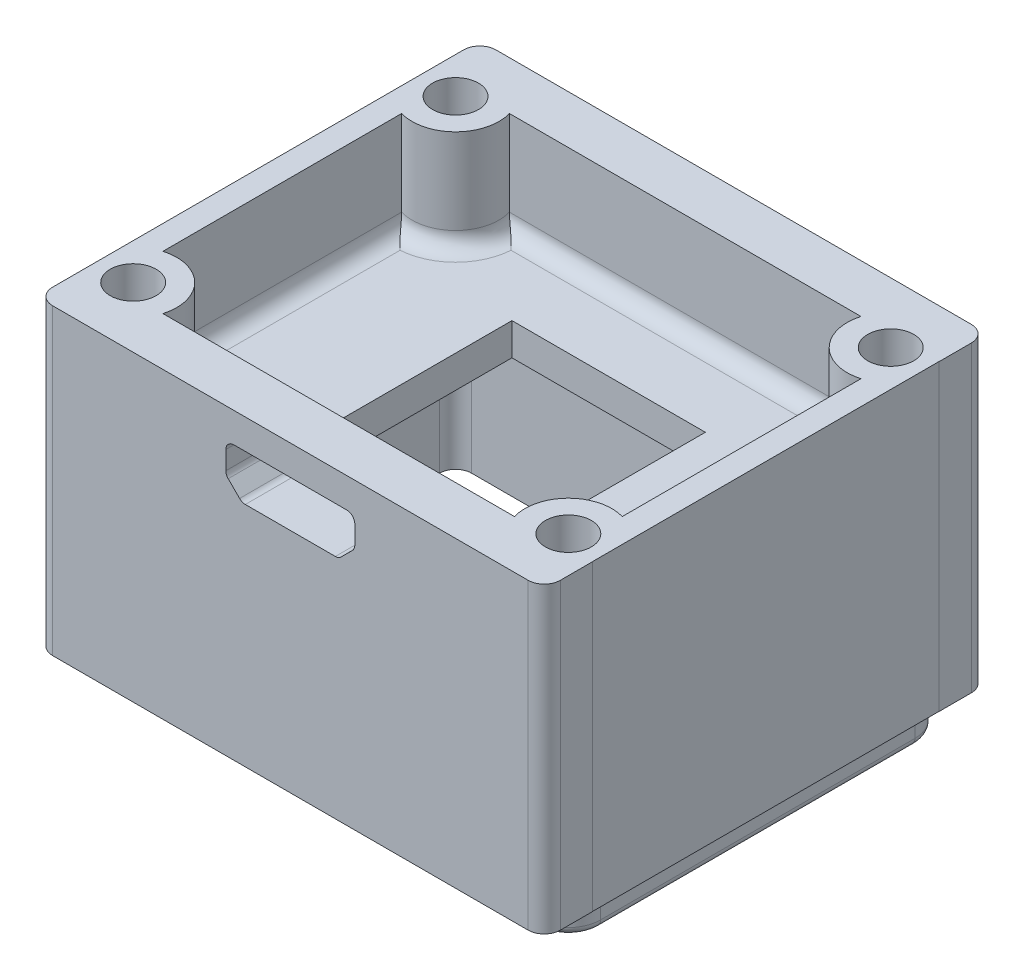
from build123d import *

# Parameters (mm, degrees)
SKETCH_1_W               = 31.500375693
SKETCH_1_H               = 27.5
EXTRUDE_1_DEPTH          = 18.8
SKETCH_2_W               = 0.007172267
SKETCH_2_H               = 21.5
CUT_EXTRUDE_1_DEPTH      = 18.8
SKETCH_3_W               = 30.5
SKETCH_3_H               = 23.5
EXTRUDE_2_DEPTH          = 1.7
SKETCH_4_W               = 28.5
SKETCH_4_H               = 21.5
CUT_EXTRUDE_2_DEPTH      = 12.2
SKETCH_5_W               = 15.8
SKETCH_5_H               = 15.8
EXTRUDE_3_DEPTH          = 0.8
CUT_EXTRUDE_3_DEPTH      = 6.3
SKETCH_7_W               = 14.2
SKETCH_7_H               = 14.2
CUT_EXTRUDE_4_DEPTH      = 0.8
SKETCH_8_W               = 12
SKETCH_8_H               = 12
CUT_EXTRUDE_5_DEPTH      = 26.276152686
CUT_EXTRUDE_6_REACH      = 39.211
HOLE_WIZARD_M2_5_1_D     = 2.85
HOLE_WIZARD_M2_5_1_DEPTH = 5.5
FILLET_1_R               = 2
FILLET_2_R               = 0.5
FILLET_3_R               = 1


with BuildPart() as part:
    # 草图1 → 凸台-拉伸1 (new body)
    with BuildSketch(Plane(origin=(0, 19.5, 0), x_dir=(1, 0, 0), z_dir=(0, 1, 0))):
        with Locations((0.003586134, 0)):
            Rectangle(SKETCH_1_W, SKETCH_1_H)
    extrude(amount=-EXTRUDE_1_DEPTH)

    # 草图2 → 切除-拉伸1 (cut)
    with BuildSketch(Plane.XZ.offset(-0.7)):
        with Locations((15.750187847, 0)):
            Rectangle(SKETCH_2_W, SKETCH_2_H)
    extrude(amount=-CUT_EXTRUDE_1_DEPTH, mode=Mode.SUBTRACT)

    # 草图3 → 凸台-拉伸2 (add)
    with BuildSketch(Plane.XZ.offset(-0.7)):
        Rectangle(SKETCH_3_W, SKETCH_3_H)
    extrude(amount=EXTRUDE_2_DEPTH)

    # 草图4 → 切除-拉伸2 (cut)
    with BuildSketch(Plane.XZ.offset(1)):
        Rectangle(SKETCH_4_W, SKETCH_4_H)
    extrude(amount=-CUT_EXTRUDE_2_DEPTH, mode=Mode.SUBTRACT)

    # 草图5 → 凸台-拉伸3 (add)
    with BuildSketch(Plane.XZ.offset(-11.2)):
        Rectangle(SKETCH_5_W, SKETCH_5_H)
    extrude(amount=EXTRUDE_3_DEPTH)

    # 草图6 → 切除-拉伸3 (cut)
    with BuildSketch(Plane(origin=(0, 19.5, 0), x_dir=(-1, 0, 0), z_dir=(0, 1, 0))):
        with BuildLine():
            Line((-14.25, 7.40625753), (-14.25, -7.40625753))
            ThreePointArc((-14.25, -7.40625753), (-11.590811691, -8.090811691), (-10.90625753, -10.75))
            Line((-10.90625753, -10.75), (10.90625753, -10.75))
            ThreePointArc((10.90625753, -10.75), (11.590811691, -8.090811691), (14.25, -7.40625753))
            Line((14.25, -7.40625753), (14.25, 7.40625753))
            ThreePointArc((14.25, 7.40625753), (11.590811691, 8.090811691), (10.90625753, 10.75))
            Line((10.90625753, 10.75), (-10.90625753, 10.75))
            ThreePointArc((-10.90625753, 10.75), (-11.590811691, 8.090811691), (-14.25, 7.40625753))
        make_face()
    extrude(amount=-CUT_EXTRUDE_3_DEPTH, mode=Mode.SUBTRACT)

    # 草图7 → 切除-拉伸4 (cut)
    with BuildSketch(Plane.XZ.offset(-10.4)):
        Rectangle(SKETCH_7_W, SKETCH_7_H)
    extrude(amount=-CUT_EXTRUDE_4_DEPTH, mode=Mode.SUBTRACT)

    # 草图8 → 切除-拉伸5 (cut, through all)
    with BuildSketch(Plane(origin=(0, 13.2, 0), x_dir=(-1, 0, 0), z_dir=(0, 1, 0))):
        Rectangle(SKETCH_8_W, SKETCH_8_H)
    extrude(amount=-CUT_EXTRUDE_5_DEPTH, mode=Mode.SUBTRACT)

    # 草图9 → 切除-拉伸6 (cut, up to next)
    with BuildSketch(Plane.XY.offset(13.75), mode=Mode.PRIVATE) as cut_extrude_6_sk1:
        Polygon((-4, 17.65), (-4, 15.8), (-3, 14.8), (3, 14.8), (4, 15.8), (4, 17.65), align=None)
    cut_extrude_6_tool1 = extrude(cut_extrude_6_sk1.sketch, amount=-CUT_EXTRUDE_6_REACH, mode=Mode.PRIVATE) & part.part
    add(cut_extrude_6_tool1.solids().sort_by_distance((0, 16.275076, 13.75))[0], mode=Mode.SUBTRACT)

    # M2.5 间隙孔1
    with Locations(Plane(origin=(0, 19.5, 0), x_dir=(1, 0, 0), z_dir=(0, 1, 0))):
        with Locations((13.5, 10), (13.5, -10), (-13.5, -10), (-13.5, 10)):
            Hole(HOLE_WIZARD_M2_5_1_D / 2, depth=HOLE_WIZARD_M2_5_1_DEPTH)

    # 圆角1
    fillet_1_edges = [part.edges().sort_by_distance(p)[0] for p in [
        (15.25, -0.15, -11.75),
        (15.25, -0.15, 11.75),
        (-15.25, -0.15, 11.75),
        (-15.25, -0.15, -11.75),
    ]]
    fillet(fillet_1_edges, radius=FILLET_1_R)

    # 圆角2
    fillet_2_edges = [part.edges().sort_by_distance(p)[0] for p in [
        (-4, 17.65, 12.25),
        (4, 17.65, 12.25),
        (4, 15.8, 12.25),
        (3, 14.8, 12.25),
        (-3, 14.8, 12.25),
        (-4, 15.8, 12.25),
        (-15.25, -1, 0),
        (0, -1, 11.75),
        (15.25, -1, 0),
        (0, -1, -11.75),
        (14.664213562, -1, -11.164213562),
        (-14.664213562, -1, -11.164213562),
        (14.664213562, -1, 11.164213562),
        (-14.664213562, -1, 11.164213562),
    ]]
    fillet(fillet_2_edges, radius=FILLET_2_R)

    # 圆角3
    # the kernel refuses this fillet: 1 mm, written as the material it adds along each edge
    with BuildSketch(Plane(origin=(-14.25, -1, 10.75), x_dir=(1, 0, 0), z_dir=(0, 1, 0))) as fillet_3_piece_1:
        with BuildLine():
            CenterArc((FILLET_3_R, FILLET_3_R), FILLET_3_R, 180, 90)
            Line((0, FILLET_3_R), (0, 0))
            Line((0, 0), (FILLET_3_R, 0))
        make_face()
    extrude(amount=14.7)
    with BuildSketch(Plane(origin=(14.25, -1, 10.75), x_dir=(-1, 0, 0), z_dir=(0, 1, 0)), Plane(origin=(14.25, -1, -10.75), x_dir=(0, 0, 1), z_dir=(0, 1, 0)), Plane(origin=(-14.25, -1, -10.75), x_dir=(1, 0, 0), z_dir=(0, 1, 0))) as fillet_3_piece_2:
        with BuildLine():
            CenterArc((FILLET_3_R, -FILLET_3_R), FILLET_3_R, 90, 90)
            Line((0, -FILLET_3_R), (0, 0))
            Line((0, 0), (FILLET_3_R, 0))
        make_face()
    extrude(amount=14.7)
    with BuildSketch(Plane(origin=(13.5, 13.2, 10), x_dir=(-0.3548034469093428, 0, 0.9349409147434126), z_dir=(0.9349409147434126, 0, 0.3548034469093428))) as fillet_3_piece_3_section:
        with BuildLine():
            CenterArc((2.7 + FILLET_3_R, -FILLET_3_R), FILLET_3_R, 90, 90)
            Line((2.7 + FILLET_3_R, 0), (2.7, 0))
            Line((2.7, 0), (2.7, -FILLET_3_R))
        make_face()
    fillet_3_piece_3 = revolve(axis=Axis((13.5, 13.2, 10), (0, -1, 0)), revolution_arc=228.43720284, mode=Mode.PRIVATE)
    fillet_3_piece_3 = split(fillet_3_piece_3, bisect_by=Plane(origin=(14.25, 13.485154119, 7.889177279), z_dir=(-1, 0, 0)), keep=Keep.TOP, mode=Mode.PRIVATE)
    add(fillet_3_piece_3)
    with BuildSketch(Plane(origin=(-13.40625753, 13.2, 10.75), x_dir=(0, 1, 0), z_dir=(1, 0, 0))) as fillet_3_piece_4_section:
        with BuildLine():
            CenterArc((FILLET_3_R, -FILLET_3_R), FILLET_3_R, 90, 90)
            Line((0, -FILLET_3_R), (0, 0))
            Line((0, 0), (FILLET_3_R, 0))
        make_face()
    fillet_3_piece_4 = extrude(amount=26.81251506, mode=Mode.PRIVATE)
    fillet_3_piece_4 = fillet_3_piece_4 - Plane(origin=(13.5, 14.049901013, 10), x_dir=(-0.9606453592105874, 0, 0.27777777777777996), z_dir=(0, 1, 0)) * Cylinder(2.7, 58, mode=Mode.PRIVATE)
    fillet_3_piece_4 = fillet_3_piece_4 - Plane(origin=(-13.5, 14.049901013, 10), x_dir=(-0.2777777777777764, 0, -0.9606453592105884), z_dir=(0, 1, 0)) * Cylinder(2.7, 58, mode=Mode.PRIVATE)
    add(fillet_3_piece_4)
    with BuildSketch(Plane(origin=(-13.5, 13.2, 10), x_dir=(-0.9349409147434112, 0, -0.35480344690934623), z_dir=(-0.35480344690934623, 0, 0.9349409147434112))) as fillet_3_piece_5_section:
        with BuildLine():
            CenterArc((2.7 + FILLET_3_R, -FILLET_3_R), FILLET_3_R, 90, 90)
            Line((2.7 + FILLET_3_R, 0), (2.7, 0))
            Line((2.7, 0), (2.7, -FILLET_3_R))
        make_face()
    fillet_3_piece_5 = revolve(axis=Axis((-13.5, 13.2, 10), (0, -1, 0)), revolution_arc=228.43720284, mode=Mode.PRIVATE)
    fillet_3_piece_5 = split(fillet_3_piece_5, bisect_by=Plane(origin=(-14.25, 13.485154119, 7.889177279), z_dir=(1, 0, 0)), keep=Keep.TOP, mode=Mode.PRIVATE)
    add(fillet_3_piece_5)
    with BuildSketch(Plane(origin=(-14.25, 13.2, -9.90625753), x_dir=(0, 1, 0), z_dir=(0, 0, 1))) as fillet_3_piece_6_section:
        with BuildLine():
            CenterArc((FILLET_3_R, -FILLET_3_R), FILLET_3_R, 90, 90)
            Line((0, -FILLET_3_R), (0, 0))
            Line((0, 0), (FILLET_3_R, 0))
        make_face()
    fillet_3_piece_6 = extrude(amount=19.81251506, mode=Mode.PRIVATE)
    fillet_3_piece_6 = fillet_3_piece_6 - Plane(origin=(-13.5, 14.049902267, 10), x_dir=(-0.2777777777777764, 0, -0.9606453592105884), z_dir=(0, 1, 0)) * Cylinder(2.7, 44, mode=Mode.PRIVATE)
    fillet_3_piece_6 = fillet_3_piece_6 - Plane(origin=(-13.5, 14.049902267, -10), x_dir=(-1, 0, 0), z_dir=(0, -1, 0)) * Cylinder(1.425, 44, mode=Mode.PRIVATE)
    add(fillet_3_piece_6)
    with BuildSketch(Plane(origin=(-13.5, 13.2, -10), x_dir=(0.35480344690934373, 0, -0.9349409147434123), z_dir=(-0.9349409147434123, 0, -0.35480344690934373))) as fillet_3_piece_7_section:
        with BuildLine():
            CenterArc((2.7 + FILLET_3_R, -FILLET_3_R), FILLET_3_R, 90, 90)
            Line((2.7 + FILLET_3_R, 0), (2.7, 0))
            Line((2.7, 0), (2.7, -FILLET_3_R))
        make_face()
    fillet_3_piece_7 = revolve(axis=Axis((-13.5, 13.2, -10), (0, -1, 0)), revolution_arc=228.43720284, mode=Mode.PRIVATE)
    fillet_3_piece_7 = split(fillet_3_piece_7, bisect_by=Plane(origin=(-14.25, 13.485154119, -7.889177279), z_dir=(1, 0, 0)), keep=Keep.TOP, mode=Mode.PRIVATE)
    add(fillet_3_piece_7)
    with BuildSketch(Plane(origin=(13.40625753, 13.2, -10.75), x_dir=(0, 1, 0), z_dir=(-1, 0, 0))) as fillet_3_piece_8_section:
        with BuildLine():
            CenterArc((FILLET_3_R, -FILLET_3_R), FILLET_3_R, 90, 90)
            Line((0, -FILLET_3_R), (0, 0))
            Line((0, 0), (FILLET_3_R, 0))
        make_face()
    fillet_3_piece_8 = extrude(amount=26.81251506, mode=Mode.PRIVATE)
    fillet_3_piece_8 = fillet_3_piece_8 - Plane(origin=(-13.5, 14.049901014, -10), x_dir=(-1, 0, 0), z_dir=(0, -1, 0)) * Cylinder(1.425, 58, mode=Mode.PRIVATE)
    fillet_3_piece_8 = fillet_3_piece_8 - Plane(origin=(13.5, 14.049901014, -10), x_dir=(-1, 0, 0), z_dir=(0, -1, 0)) * Cylinder(1.425, 58, mode=Mode.PRIVATE)
    add(fillet_3_piece_8)
    with BuildSketch(Plane(origin=(13.5, 13.2, -10), x_dir=(0.9349409147434106, 0, 0.3548034469093482), z_dir=(0.3548034469093482, 0, -0.9349409147434106))) as fillet_3_piece_9_section:
        with BuildLine():
            CenterArc((2.7 + FILLET_3_R, -FILLET_3_R), FILLET_3_R, 90, 90)
            Line((2.7 + FILLET_3_R, 0), (2.7, 0))
            Line((2.7, 0), (2.7, -FILLET_3_R))
        make_face()
    fillet_3_piece_9 = revolve(axis=Axis((13.5, 13.2, -10), (0, -1, 0)), revolution_arc=228.43720284, mode=Mode.PRIVATE)
    fillet_3_piece_9 = split(fillet_3_piece_9, bisect_by=Plane(origin=(14.25, 13.485154119, -7.889177279), z_dir=(-1, 0, 0)), keep=Keep.TOP, mode=Mode.PRIVATE)
    add(fillet_3_piece_9)
    with BuildSketch(Plane(origin=(14.25, 13.2, 9.90625753), x_dir=(0, 1, 0), z_dir=(0, 0, -1))) as fillet_3_piece_10_section:
        with BuildLine():
            CenterArc((FILLET_3_R, -FILLET_3_R), FILLET_3_R, 90, 90)
            Line((0, -FILLET_3_R), (0, 0))
            Line((0, 0), (FILLET_3_R, 0))
        make_face()
    fillet_3_piece_10 = extrude(amount=19.81251506, mode=Mode.PRIVATE)
    fillet_3_piece_10 = fillet_3_piece_10 - Plane(origin=(13.5, 14.049902266, 10), x_dir=(-0.9606453592105874, 0, 0.27777777777777996), z_dir=(0, 1, 0)) * Cylinder(2.7, 44, mode=Mode.PRIVATE)
    fillet_3_piece_10 = fillet_3_piece_10 - Plane(origin=(13.5, 14.049902266, -10), x_dir=(-1, 0, 0), z_dir=(0, -1, 0)) * Cylinder(1.425, 44, mode=Mode.PRIVATE)
    add(fillet_3_piece_10)
    # the kernel refuses this fillet: 1 mm, written as the material it takes off along each edge
    with BuildSketch(Plane(origin=(15.75377398, 22, -13.75), x_dir=(0, 0, 1), z_dir=(0, -1, 0)), Plane(origin=(15.75377398, 22, 13.75), x_dir=(-1, 0, 0), z_dir=(0, -1, 0)), Plane(origin=(-15.746601713, 22, -13.75), x_dir=(1, 0, 0), z_dir=(0, -1, 0))) as fillet_3_2_piece_1:
        with BuildLine():
            CenterArc((FILLET_3_R, FILLET_3_R), FILLET_3_R, 180, 90)
            Line((0, FILLET_3_R), (0, 0))
            Line((0, 0), (FILLET_3_R, 0))
        make_face()
    extrude(amount=23.8, mode=Mode.SUBTRACT)
    with BuildSketch(Plane(origin=(-15.746601713, 22, 13.75), x_dir=(1, 0, 0), z_dir=(0, -1, 0))) as fillet_3_2_piece_2:
        with BuildLine():
            CenterArc((FILLET_3_R, -FILLET_3_R), FILLET_3_R, 90, 90)
            Line((0, -FILLET_3_R), (0, 0))
            Line((0, 0), (FILLET_3_R, 0))
        make_face()
    extrude(amount=23.8, mode=Mode.SUBTRACT)


solid = part.part
